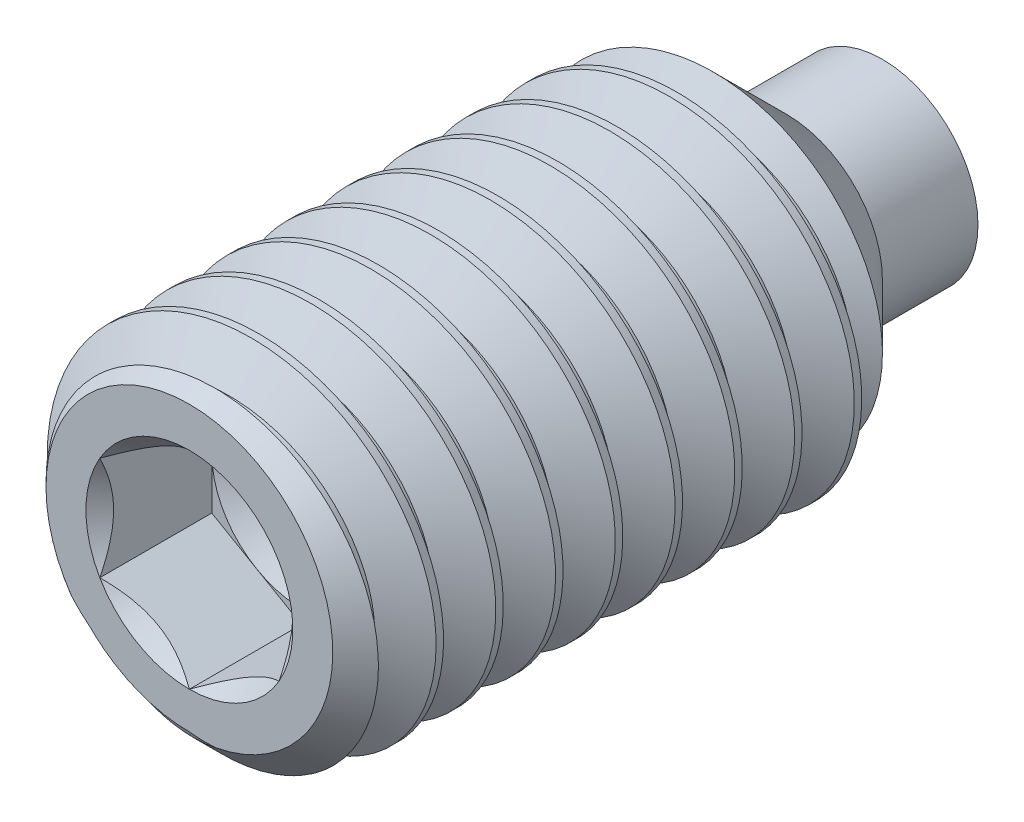
from build123d import *

# Parameters (mm, degrees)
CUT_SWEEP1_PITCH   = 1
CUT_EXTRUDE1_DEPTH = 1.875


with BuildPart() as part:
    # Sketch22 → Revolve1 (revolve)
    with BuildSketch(Plane(origin=(0, 0, 0), x_dir=(0, 0, -1), z_dir=(1, 0, 0)), mode=Mode.PRIVATE) as revolve1_sk:
        Polygon((-11.6, 0), (-11.6, 2.4), (-11, 3), (-3, 3), (-1.6, 1.6), (0, 1.6), (0, 0), align=None)
    revolve(revolve1_sk.sketch.rotate(Axis((0, 0, 12.7), (0, 0, -1)), 90), axis=Axis((0, 0, 12.7), (0, 0, -1)))

    # Cut-Sweep1: the profile of Sketch6 profile screwed along a right-hand helix of 11 turns, 8 arcs to a turn; built about Z, then put on its axis
    cut_sweep1_z = Axis((0, 0, 0), (0, 0, 1))
    cut_sweep1_corners = [(2.350480947, 0, -0.5), (2.350480947, 0, -0.375), (3.0003, 0, 0.000173205), (3.0003, 0, -0.875173205)]
    with BuildLine(mode=Mode.PRIVATE) as cut_sweep1_profile:
        Line(cut_sweep1_corners[0], cut_sweep1_corners[1])
        Line(cut_sweep1_corners[1], cut_sweep1_corners[2])
        Line(cut_sweep1_corners[2], cut_sweep1_corners[3])
        Line(cut_sweep1_corners[3], cut_sweep1_corners[0])
    cut_sweep1_cap = Face(cut_sweep1_profile.wire())
    cut_sweep1_turn_angles = [0, 22.5, 45, 67.5, 90, 112.5, 135, 157.5, 180, 202.5, 225, 247.5, 270, 292.5, 315, 337.5, 360]
    cut_sweep1_turn_weights = [1, 0.9238795325112867, 1, 0.9238795325112867, 1, 0.9238795325112867, 1, 0.9238795325112867, 1, 0.9238795325112867, 1, 0.9238795325112867, 1, 0.9238795325112867, 1, 0.9238795325112867, 1]
    cut_sweep1_turn_rails = [Edge.make_bspline([Vector(p[0], p[1], 0).rotate(cut_sweep1_z, cut_sweep1_turn_angles[k]) / cut_sweep1_turn_weights[k] + Vector(0, 0, p[2] + CUT_SWEEP1_PITCH * cut_sweep1_turn_angles[k] / 360) for k in range(17)], [0, 0, 0, 1, 1, 2, 2, 3, 3, 4, 4, 5, 5, 6, 6, 7, 7, 8, 8, 8], 2, cut_sweep1_turn_weights) for p in cut_sweep1_corners]
    cut_sweep1_turn_sides = [Face.make_surface_from_curves(cut_sweep1_turn_rails[p[0]], cut_sweep1_turn_rails[p[1]]) for p in [(0, 1), (1, 2), (2, 3), (3, 0)]]
    cut_sweep1 = Plane(origin=(0, 0, 1.6), x_dir=(0, 1, 0), z_dir=(0, 0, 1)) * Solid(Shell([*[p.moved(Location((0, 0, CUT_SWEEP1_PITCH * i))) for i in range(11) for p in cut_sweep1_turn_sides], cut_sweep1_cap, cut_sweep1_cap.rotate(cut_sweep1_z, 3960).moved(Location((0, 0, CUT_SWEEP1_PITCH * 3960 / 360)))]))
    add(cut_sweep1, mode=Mode.SUBTRACT)

    # Sketch30 → Cut-Extrude1 (cut)
    with BuildSketch(Plane.XY.offset(11.6)):
        Polygon((1.5, -0.866025404), (1.5, 0.866025404), (0, 1.732050808), (-1.5, 0.866025404), (-1.5, -0.866025404), (0, -1.732050808), align=None)
    extrude(amount=-CUT_EXTRUDE1_DEPTH, mode=Mode.SUBTRACT)

    # Cut-Extrude2 cone 1 section (through the dimple's axis) → Cut-Extrude2 (revolve, cut)
    with BuildSketch(Plane(origin=(0, 0, 11.6), x_dir=(0, -1, 0), z_dir=(1, 0, 0))):
        Polygon((0, 0), (1.732050808, 0), (0, 1.732050808), align=None)
    revolve(axis=Axis((0, 0, 11.6), (0, 0, -1)), mode=Mode.SUBTRACT)

    # Cut-Extrude3 cone 1 section (through the dimple's axis) → Cut-Extrude3 (revolve, cut)
    with BuildSketch(Plane(origin=(0, 0, 9.725), x_dir=(0, -1, 0), z_dir=(1, 0, 0))):
        Polygon((0, 0), (1.5, 0), (0, 0.866025404), align=None)
    revolve(axis=Axis((0, 0, 9.725), (0, 0, -1)), mode=Mode.SUBTRACT)


solid = part.part
